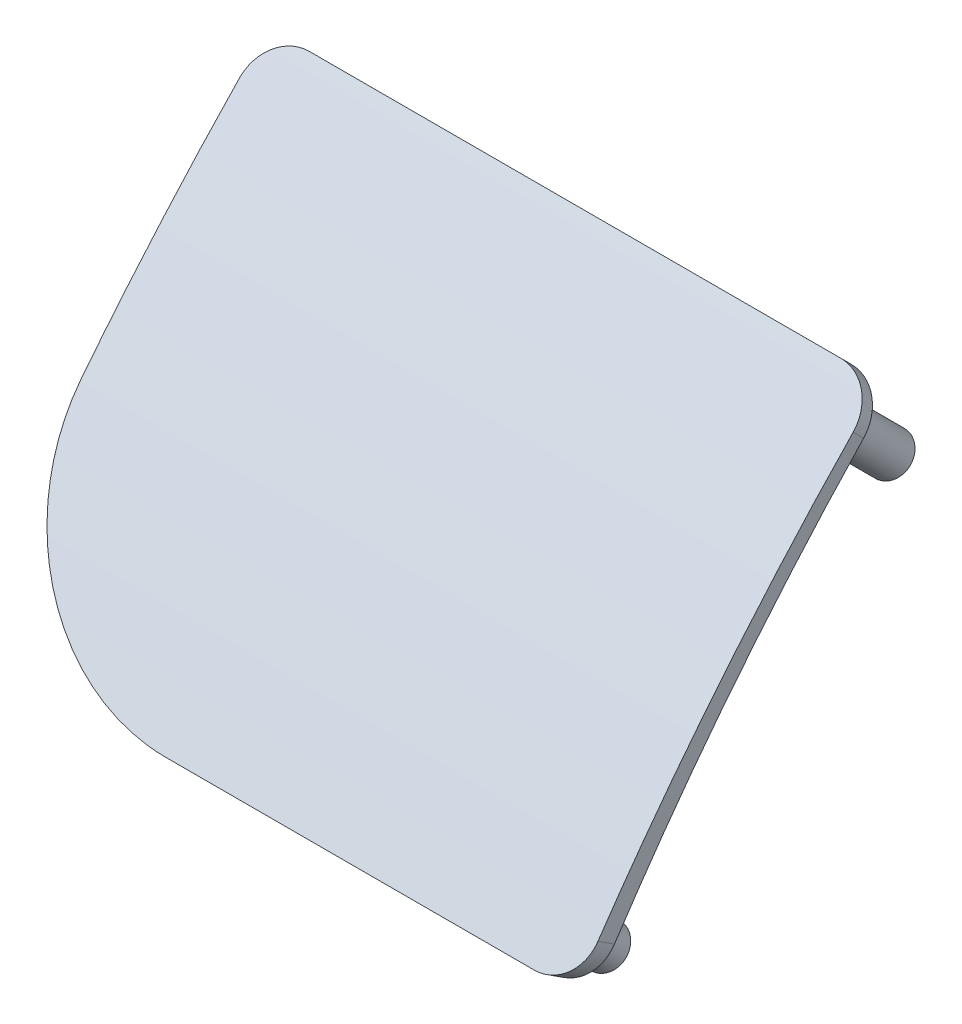
from build123d import *

# Parameters (mm, degrees)
LOFT_START          = -150
LOFT_18_DEPTH       = 150
FILLET_1_R          = 50
SKETCH_8_W          = 150
SKETCH_8_H          = 89.90044461
CUT_EXTRUDE_3_DEPTH = 194.637322649
FILLET_3_R          = 10
EXTRUDE_1_REACH     = 195.637
SKETCH_5_R          = 5


# Read off the part's stored shape, not the designer's step: 放样18
with BuildPart() as part:
    # 放样18 outline → 放样18 (new body)
    with BuildSketch(Plane.YZ.offset(LOFT_START)):
        with BuildLine():
            Line((-92.019059125, 77.475043518), (-94.7292742, 73.273289807))
            add(Edge.make_bspline(
                [(-2.5, 0), (-30.482362978, 27.663701514), (-61.402130233, 52.230749004), (-94.7292742, 73.273289807)],
                knots=[0, 0, 0, 0, 1, 1, 1, 1], degree=3))
            Line((-2.5, 0), (2.5, 0))
            add(Edge.make_bspline(
                [(2.5, 0), (-26.24562462, 29.064286084), (-57.928653516, 55.031918144), (-92.019059125, 77.475043518)],
                knots=[0, 0, 0, 0, 1, 1, 1, 1], degree=3))
        make_face()
    extrude(amount=LOFT_18_DEPTH)

    # 圆角1
    fillet_1_edges = [part.edges().sort_by_distance(p)[0] for p in [
        (-150, -93.374166663, 75.374166663),
    ]]
    fillet(fillet_1_edges, radius=FILLET_1_R)

    # 草图8 → 切除-拉伸3 (cut, through all)
    with BuildSketch(Plane(origin=(0, -17.799060008, -17.799060008), x_dir=(-1, 0, 0), z_dir=(0, 0.7071067811865488, 0.7071067811865464))):
        with Locations((75, -43.182455352)):
            Rectangle(SKETCH_8_W, SKETCH_8_H)
    extrude(amount=CUT_EXTRUDE_3_DEPTH, mode=Mode.SUBTRACT)

    # 圆角3
    fillet_3_edges = [part.edges().sort_by_distance(p)[0] for p in [
        (0, -93.374166663, 75.374166663),
        (0, -1.246870677, 1.253129323),
        (-150, -1.246870677, 1.253129323),
    ]]
    fillet(fillet_3_edges, radius=FILLET_3_R)

    # 草图5 → 凸台-拉伸1 (add, up to next)
    with BuildSketch(Plane(origin=(0, -17.799060008, -17.799060008), x_dir=(-1, 0, 0), z_dir=(0, 0.7071067811865488, 0.7071067811865464)), mode=Mode.PRIVATE) as extrude_1_sk1:
        with Locations(Location((140, 11.767766953, 0), (0, 0, 270))):
            Circle(SKETCH_5_R)
    extrude_1_tool1 = extrude(extrude_1_sk1.sketch, amount=EXTRUDE_1_REACH, mode=Mode.PRIVATE) - part.part
    # 草图5 → 凸台-拉伸1 (add, up to next)
    with BuildSketch(Plane(origin=(0, -17.799060008, -17.799060008), x_dir=(-1, 0, 0), z_dir=(0, 0.7071067811865488, 0.7071067811865464)), mode=Mode.PRIVATE) as extrude_1_sk2:
        with Locations(Location((10, 11.767766953, 0), (0, 0, 270))):
            Circle(SKETCH_5_R)
    extrude_1_tool2 = extrude(extrude_1_sk2.sketch, amount=EXTRUDE_1_REACH, mode=Mode.PRIVATE) - part.part
    # 草图5 → 凸台-拉伸1 (add, up to next)
    with BuildSketch(Plane(origin=(0, -17.799060008, -17.799060008), x_dir=(-1, 0, 0), z_dir=(0, 0.7071067811865488, 0.7071067811865464)), mode=Mode.PRIVATE) as extrude_1_sk3:
        with Locations(Location((10, 110.037688609, 0), (0, 0, 270))):
            Circle(SKETCH_5_R)
    extrude_1_tool3 = extrude(extrude_1_sk3.sketch, amount=EXTRUDE_1_REACH, mode=Mode.PRIVATE) - part.part
    # 草图5 → 凸台-拉伸1 (add, up to next)
    with BuildSketch(Plane(origin=(0, -17.799060008, -17.799060008), x_dir=(-1, 0, 0), z_dir=(0, 0.7071067811865488, 0.7071067811865464)), mode=Mode.PRIVATE) as extrude_1_sk4:
        with Locations(Location((100, 70.425532461, 0), (0, 0, 270))):
            Circle(SKETCH_5_R)
    extrude_1_tool4 = extrude(extrude_1_sk4.sketch, amount=EXTRUDE_1_REACH, mode=Mode.PRIVATE) - part.part
    add(extrude_1_tool1.solids().sort_by_distance((-140, -26.120128, -9.477992))[0])
    add(extrude_1_tool2.solids().sort_by_distance((-10, -26.120128, -9.477992))[0])
    add(extrude_1_tool3.solids().sort_by_distance((-10, -95.607456, 60.009336))[0])
    add(extrude_1_tool4.solids().sort_by_distance((-100, -67.597432, 31.999312))[0])


solid = part.part
